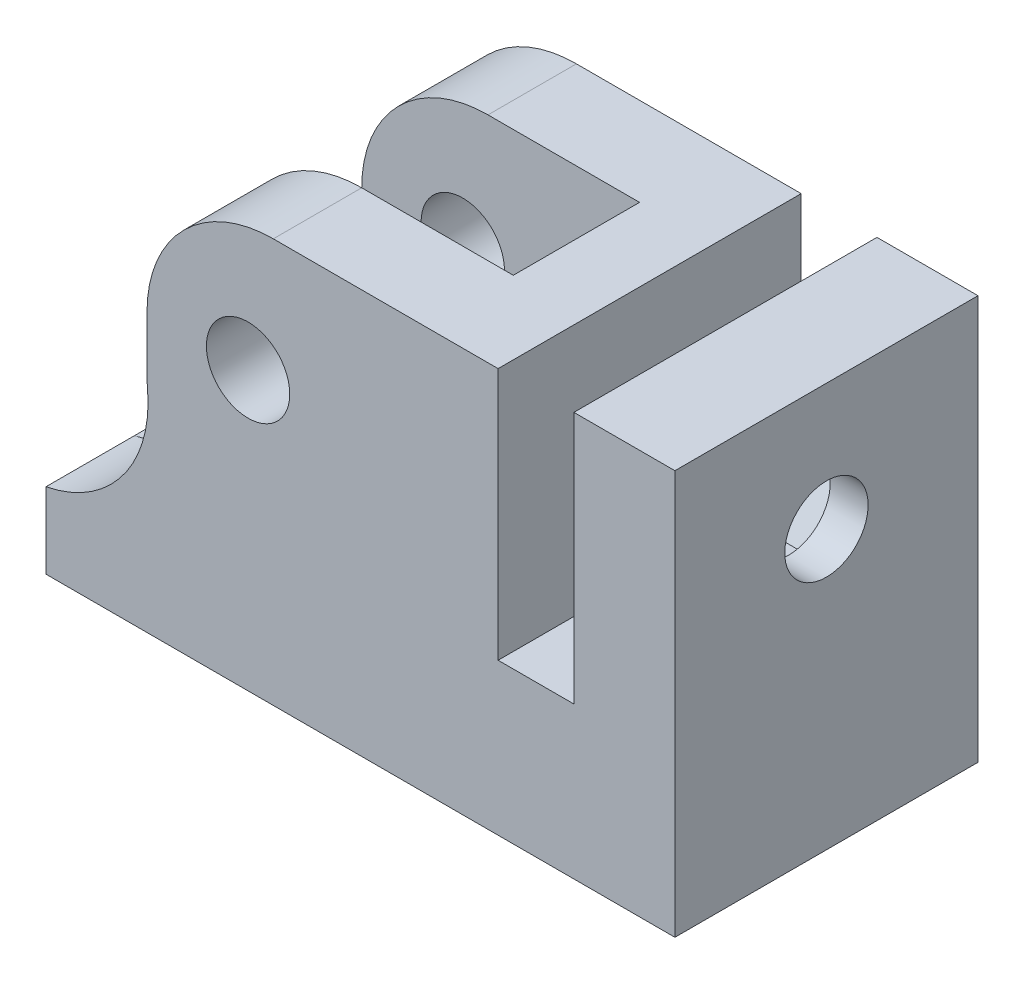
from build123d import *

# Parameters (mm, degrees)
ESBO_O1_R                = 1.65
RESSALTO_EXTRUS_O1_DEPTH = 12
ESBO_O2_W                = 11
ESBO_O2_H                = 5
CORTE_EXTRUS_O1_DEPTH    = 25.355902775
FILETE1_R                = 5
ESBO_O3_R                = 1.65
CORTE_EXTRUS_O2_DEPTH    = 2.5
ESBO_O3_2_R              = 1.65
CORTE_EXTRUS_O3_DEPTH    = 27.184155514
RESSALTO_EXTRUS_O2_DEPTH = 3
FILETE2_R                = 5


with BuildPart() as part:
    # Esboço1 → Ressalto-extrusão1 (new body)
    with BuildSketch(Plane.XY):
        Polygon((0, 0), (-13.9, 0), (-13.9, -10), (-4, -16), (7, -16), (7, 0), (3, 0), (3, -10), (0, -10), align=None)
        with Locations((-9.9, -5)):
            Circle(ESBO_O1_R, mode=Mode.SUBTRACT)
    extrude(amount=RESSALTO_EXTRUS_O1_DEPTH)

    # Esboço2 → Corte-extrusão1 (cut, through all)
    with BuildSketch(Plane(origin=(0, 0, 0), x_dir=(1, 0, 0), z_dir=(0, 1, 0))):
        with Locations((-8.4, -6)):
            Rectangle(ESBO_O2_W, ESBO_O2_H)
    extrude(amount=-CORTE_EXTRUS_O1_DEPTH, mode=Mode.SUBTRACT)

    # Filete1
    filete1_edges = [part.edges().sort_by_distance(p)[0] for p in [
        (-4, -16, 1.75),
        (-13.9, -10, 10.25),
        (-13.9, -10, 1.75),
        (-13.9, 0, 1.75),
        (-13.9, 0, 10.25),
    ]]
    fillet(filete1_edges, radius=FILETE1_R)

    # Esboço3 → Corte-extrusão2 (cut)
    with BuildSketch(Plane.ZY.offset(-3)):
        Polygon((2.535898385, -5), (4.267949192, -8), (7.732050808, -8), (9.464101615, -5), (7.732050808, -2), (4.267949192, -2), align=None)
        with Locations(Location((6, -5, 0), (0, 0, 270))):
            Circle(ESBO_O3_R, mode=Mode.SUBTRACT)
    extrude(amount=-CORTE_EXTRUS_O2_DEPTH, mode=Mode.SUBTRACT)

    # Esboço3<2> → Corte-extrusão3 (cut, through all)
    with BuildSketch(Plane.ZY.offset(-3)):
        with Locations(Location((6, -5, 0), (0, 0, 270))):
            Circle(ESBO_O3_2_R)
    extrude(amount=-CORTE_EXTRUS_O3_DEPTH, mode=Mode.SUBTRACT)

    # Esboço4 → Ressalto-extrusão2 (add)
    with BuildSketch(Plane.XZ.offset(16)):
        with BuildLine():
            Line((7, 12), (-17.9, 12))
            Line((-17.9, 12), (-17.9, 0))
            Line((-17.9, 0), (-14.4, 0))
            Line((-14.4, 0), (-14.4, 4.5))
            ThreePointArc((-14.4, 4.5), (-15.9, 6), (-14.4, 7.5))
            Line((-14.4, 7.5), (-5.4, 7.5))
            ThreePointArc((-5.4, 7.5), (-3.9, 6), (-5.4, 4.5))
            Line((-5.4, 4.5), (-5.4, 0))
            Line((-5.4, 0), (7, 0))
            Line((7, 0), (7, 12))
        make_face()
    extrude(amount=-RESSALTO_EXTRUS_O2_DEPTH)

    # Filete2
    # the kernel refuses this fillet: 5 mm, written as the material it adds along each edge
    with BuildSketch(Plane(origin=(-8.95, -13, 12), x_dir=(-1, 0, 0), z_dir=(0, 0, -1))) as filete2_piece_1:
        with BuildLine():
            CenterArc((9.908595848, 4.907249128), FILETE2_R, 174.784336803, 84.162533203)
            Line((4.929297924, 5.361773258), (4.431368132, 5.407225671))
            ThreePointArc((4.431368132, 5.407225671), (2.282357722, 1.967907146), (-0.259150858, 0.427598916))
            Line((-0.259150858, 0.427598916), (0, -0.5))
            ThreePointArc((0, -0.5), (4.475, -0.5), (8.854140415, -0.490724913))
            Line((8.854140415, -0.490724913), (8.95, 0))
        make_face()
    extrude(amount=3.5)


solid = part.part
